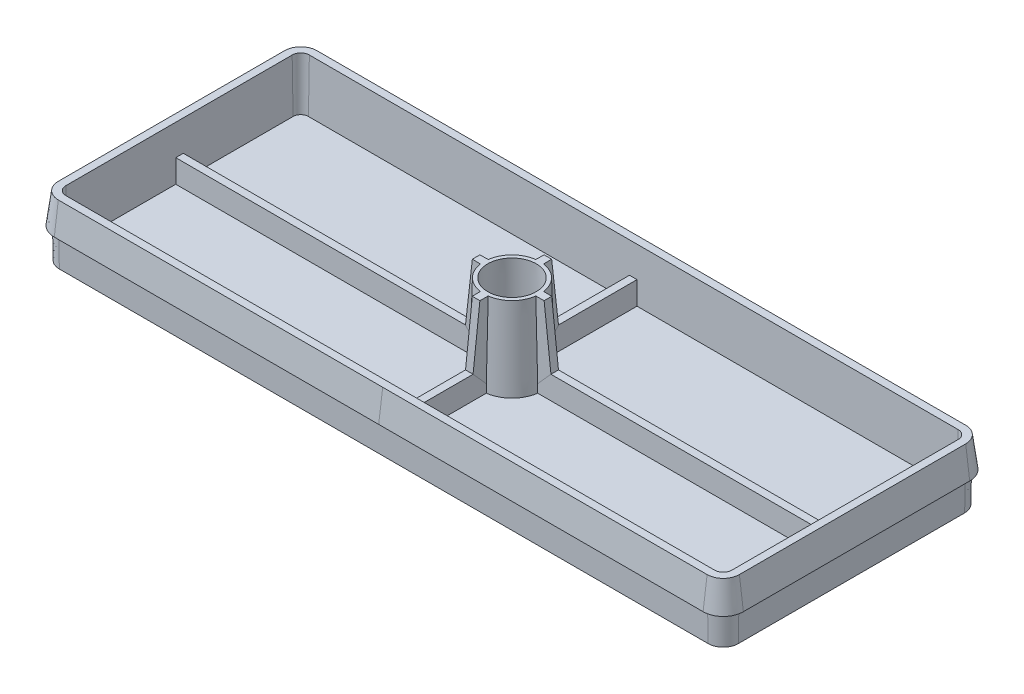
from build123d import *

# Parameters (mm, degrees)
BOSS_EXTRUDE1_DEPTH = 4
BOSS_EXTRUDE1_DRAFT = -1
SHELL1_T            = -0.5
SKETCH2_R           = 2
BOSS_EXTRUDE2_DEPTH = 5.5
BOSS_EXTRUDE2_TAPER = 1.5
CIRPATTERN1_COUNT   = 4
SKETCH4_R           = 1.605977431
CUT_EXTRUDE1_DEPTH  = 5.5
CUT_EXTRUDE1_DRAFT  = 1.5
RIB3_START          = -22.069744096
RIB3_DEPTH          = 20.231981802
RIB3_START_2        = 1.837762294
RIB3_2_DEPTH        = 20.231981802
RIB3_START_3        = -8.069744096
RIB3_3_DEPTH        = 6.231981802
RIB3_4_DEPTH        = 6.231981802


with BuildPart() as part:
    # Sketch1 → Boss-Extrude1 (with draft: the straight prism first)
    with BuildSketch(Plane(origin=(0, 0, 0), x_dir=(1, 0, 0), z_dir=(0, 1, 0))):
        with BuildLine():
            Line((-21.5, -8.5), (21.5, -8.5))
            ThreePointArc((21.5, -8.5), (22.207106781, -8.207106781), (22.5, -7.5))
            Line((22.5, -7.5), (22.5, 7.5))
            ThreePointArc((22.5, 7.5), (22.207106781, 8.207106781), (21.5, 8.5))
            Line((21.5, 8.5), (-21.5, 8.5))
            ThreePointArc((-21.5, 8.5), (-22.207106781, 8.207106781), (-22.5, 7.5))
            Line((-22.5, 7.5), (-22.5, -7.5))
            ThreePointArc((-22.5, -7.5), (-22.207106781, -8.207106781), (-21.5, -8.5))
        make_face()
    extrude(amount=BOSS_EXTRUDE1_DEPTH)
    # Boss-Extrude1: the draft: its side faces are tilted about the plane it starts from
    boss_extrude1_sides = [part.faces().sort_by_distance(p)[0] for p in [
        (0, 2, 8.5),
        (22.207106781, 2, 8.207106781),
        (22.5, 2, 0),
        (22.207106781, 2, -8.207106781),
        (0, 2, -8.5),
        (-22.207106781, 2, -8.207106781),
        (-22.5, 2, 0),
        (-22.207106781, 2, 8.207106781),
    ]]
    draft(boss_extrude1_sides, Plane(origin=(0, 0, 0), x_dir=(1, 0, 0), z_dir=(0, 1, 0)), BOSS_EXTRUDE1_DRAFT)

    # Shell1
    shell1_openings = [part.faces().sort_by_distance(p)[0] for p in [
        (0, 4, 0),
    ]]
    offset(amount=SHELL1_T, openings=shell1_openings, kind=Kind.INTERSECTION)

    # Sketch2 → Boss-Extrude2 (add)
    with BuildSketch(Plane(origin=(0, 0.5, 0), x_dir=(1, 0, 0), z_dir=(0, 1, 0))):
        Circle(SKETCH2_R)
    extrude(amount=BOSS_EXTRUDE2_DEPTH, taper=BOSS_EXTRUDE2_TAPER)

    # Rib2: read off the stored shape, not the designer's step
    # Rib2: loft between two sections, ruled curve by curve
    rib2_from = [
        Edge.make_line((1.837762394, 6, 0.25938699), (2.378960183, 6, 0.25)),
        Edge.make_line((1.837762394, 6, -0.25938699), (2.378960183, 6, -0.25)),
        Edge.make_line((2.378960183, 6, -0.25), (2.378960183, 6, 0.25)),
        Edge.make_line((1.837762394, 6, -0.25938699), (1.837762394, 6, 0.25938699)),
    ]
    rib2_to = [
        Edge.make_line((1.982009028, 0.5, 0.267656891), (3, 0.5, 0.25)),
        Edge.make_line((1.982009028, 0.5, -0.267656891), (3, 0.5, -0.25)),
        Edge.make_line((3, 0.5, -0.25), (3, 0.5, 0.25)),
        Edge.make_line((1.982009028, 0.5, -0.267656891), (1.982009028, 0.5, 0.267656891)),
    ]
    rib2 = Solid(Shell([*[Face.make_surface_from_curves(rib2_from[k], rib2_to[k]) for k in range(4)], Face(Wire(rib2_from)), Face(Wire(rib2_to))]))
    add(rib2)

    # CirPattern1: Rib2 ×4 about axis
    cirpattern1_axis = Axis((0, 0, 0), (0, 1, 0))
    for i in range(1, CIRPATTERN1_COUNT):
        add(rib2.rotate(cirpattern1_axis, i * 360 / CIRPATTERN1_COUNT))


with BuildPart() as cut_extrude1_tool:
    # Sketch4 → Cut-Extrude1 (with draft: the straight prism first)
    with BuildSketch(Plane(origin=(0, 6, 0), x_dir=(1, 0, 0), z_dir=(0, 1, 0))):
        Circle(SKETCH4_R)
    extrude(amount=-CUT_EXTRUDE1_DEPTH)
    # Cut-Extrude1: the draft: its side faces are tilted about the plane it starts from
    cut_extrude1_sides = [cut_extrude1_tool.faces().sort_by_distance(p)[0] for p in [
        (-1.605977431, 3.25, 0),
    ]]
    draft(cut_extrude1_sides, Plane(origin=(0, 6, 0), x_dir=(1, 0, 0), z_dir=(0, 1, 0)), CUT_EXTRUDE1_DRAFT)


with BuildPart() as part_1:
    add(part.part)

    # Cut-Extrude1: cut by cut_extrude1_tool
    add(cut_extrude1_tool.part, mode=Mode.SUBTRACT)

    # Rib3: read off the stored shape, not the designer's step
    # Rib3 outline → Rib3 (add)
    with BuildSketch(Plane.YZ.offset(RIB3_START)):
        Polygon((0.5, -0.276182597), (2, -0.25), (2, 0.25), (0.5, 0.276182597), align=None)
    extrude(amount=RIB3_DEPTH)

    # Rib3 2 outline → Rib3 2 (add)
    with BuildSketch(Plane.YZ.offset(RIB3_START_2)):
        Polygon((0.5, -0.276182597), (2, -0.25), (2, 0.25), (0.5, 0.276182597), align=None)
    extrude(amount=RIB3_2_DEPTH)

    # Rib3 3 outline → Rib3 3 (add)
    with BuildSketch(Plane.XY.offset(RIB3_START_3)):
        Polygon((0.276182597, 0.5), (0.25, 2), (-0.25, 2), (-0.276182597, 0.5), align=None)
    extrude(amount=RIB3_3_DEPTH)

    # Rib3 4 outline → Rib3 4 (add)
    with BuildSketch(Plane.XY.offset(RIB3_START_2)):
        Polygon((0.276182597, 0.5), (0.25, 2), (-0.25, 2), (-0.276182597, 0.5), align=None)
    extrude(amount=RIB3_4_DEPTH)

    # Sweep1: sweep along a path in Sketch8
    with BuildLine(Plane(origin=(0, 2, 0), x_dir=(-1, 0, 0), z_dir=(0, -1, 0))) as sweep1_path:
        Line((22.56982026, 7.5), (22.56982026, -7.5))
        ThreePointArc((22.56982026, -7.5), (22.25647716, -8.25647716), (21.5, -8.56982026))
        Line((21.5, -8.56982026), (-21.5, -8.56982026))
        ThreePointArc((-21.5, -8.56982026), (-22.25647716, -8.25647716), (-22.56982026, -7.5))
        Line((-22.56982026, -7.5), (-22.56982026, 7.5))
        ThreePointArc((-22.56982026, 7.5), (-22.25647716, 8.25647716), (-21.5, 8.56982026))
        Line((-21.5, 8.56982026), (21.5, 8.56982026))
        ThreePointArc((21.5, 8.56982026), (22.25647716, 8.25647716), (22.56982026, 7.5))
    # Sketch5 → Sweep1 (sweep)
    with BuildSketch(Plane(origin=(0, 0, 0), x_dir=(0, 0, -1), z_dir=(1, 0, 0))):
        Polygon((-8.83491013, 2), (-8.56982026, 4), (-8.53491013, 2), align=None)
    sweep(path=sweep1_path.line)


solid = part_1.part
